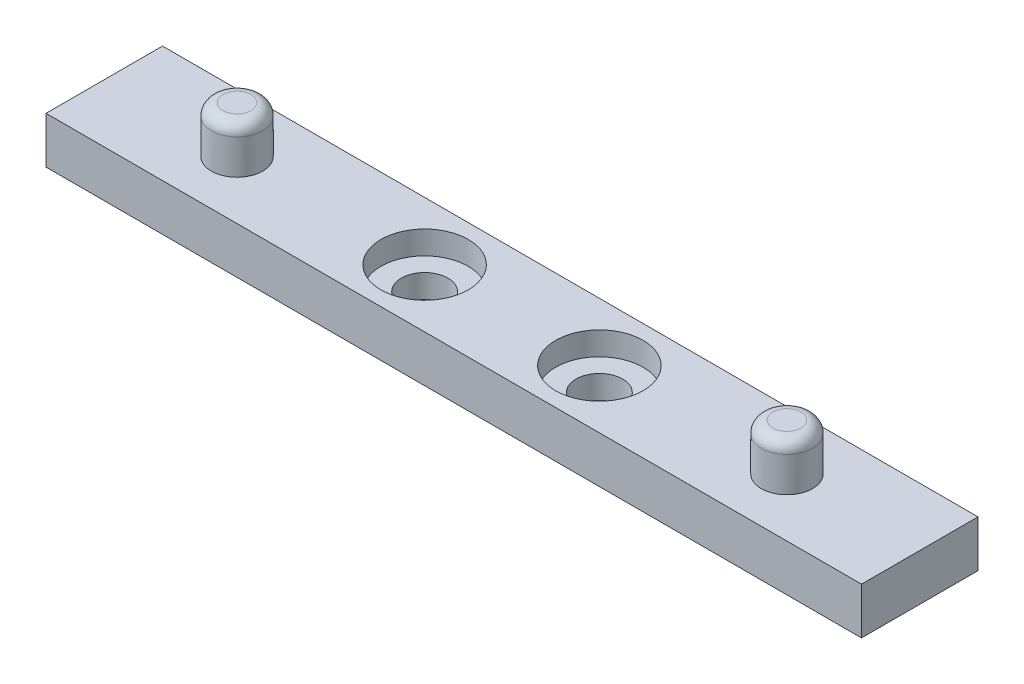
from build123d import *

# Parameters (mm, degrees)
SKETCH1_W           = 88.9
SKETCH1_H           = 12.7
SKETCH1_R           = 2.54
BOSS_EXTRUDE2_DEPTH = 5.08
SKETCH2_R           = 2.794
BOSS_EXTRUDE3_DEPTH = 5.08
FILLET1_R           = 1.27
SKETCH3_R           = 4.7625
CUT_EXTRUDE1_DEPTH  = 2.54


with BuildPart() as part:
    # Sketch1 → Boss-Extrude2 (new body)
    with BuildSketch(Plane(origin=(0, 0, 0), x_dir=(1, 0, 0), z_dir=(0, 1, 0))):
        with Locations((44.45, 6.35)):
            Rectangle(SKETCH1_W, SKETCH1_H)
        with Locations((34.925, 6.35)):
            Circle(SKETCH1_R, mode=Mode.SUBTRACT)
        with Locations((53.975, 6.35)):
            Circle(SKETCH1_R, mode=Mode.SUBTRACT)
    extrude(amount=BOSS_EXTRUDE2_DEPTH)

    # Sketch2 → Boss-Extrude3 (add)
    with BuildSketch(Plane(origin=(0, 5.08, 0), x_dir=(1, 0, 0), z_dir=(0, 1, 0))):
        with Locations((14.478, 6.35)):
            Circle(SKETCH2_R)
        with Locations((74.422, 6.35)):
            Circle(SKETCH2_R)
    extrude(amount=BOSS_EXTRUDE3_DEPTH)

    # Fillet1
    fillet1_edges = [part.edges().sort_by_distance(p)[0] for p in [
        (71.628, 10.16, -6.35),
        (11.684, 10.16, -6.35),
    ]]
    fillet(fillet1_edges, radius=FILLET1_R)

    # Sketch3 → Cut-Extrude1 (cut)
    with BuildSketch(Plane(origin=(0, 5.08, 0), x_dir=(1, 0, 0), z_dir=(0, 1, 0))):
        with Locations((34.925, 6.35)):
            Circle(SKETCH3_R)
        with Locations((53.975, 6.35)):
            Circle(SKETCH3_R)
    extrude(amount=-CUT_EXTRUDE1_DEPTH, mode=Mode.SUBTRACT)


solid = part.part
